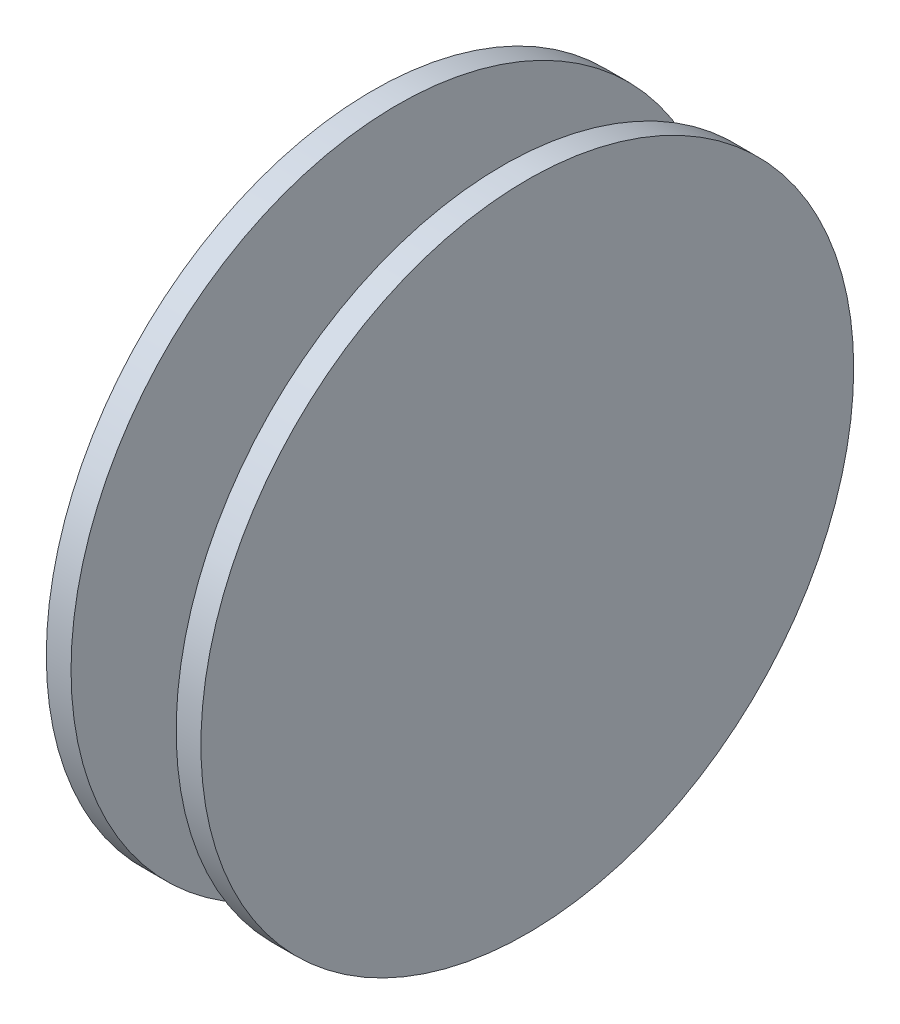
from build123d import *

# Parameters (mm, degrees)
SKETCH4_R           = 83.82
BOSS_EXTRUDE1_DEPTH = 6.35
SKETCH5_R           = 5
BOSS_EXTRUDE4_DEPTH = 27
BOSS_EXTRUDE5_START = 6.35
SKETCH7_R           = 83.82
BOSS_EXTRUDE5_DEPTH = 6.35


with BuildPart() as part:
    # Sketch4 → Boss-Extrude1 (new body)
    with BuildSketch(Plane(origin=(0, 0, 0), x_dir=(0, 0, -1), z_dir=(1, 0, 0))):
        Circle(SKETCH4_R)
    extrude(amount=BOSS_EXTRUDE1_DEPTH)

    # Sketch5 → Boss-Extrude4 (add)
    with BuildSketch(Plane.ZY):
        Circle(SKETCH5_R)
    extrude(amount=BOSS_EXTRUDE4_DEPTH)

    # Sketch7 → Boss-Extrude5 (add)
    with BuildSketch(Plane.ZY.offset(27).offset(BOSS_EXTRUDE5_START)):
        Circle(SKETCH7_R)
    extrude(amount=-BOSS_EXTRUDE5_DEPTH)


solid = part.part
